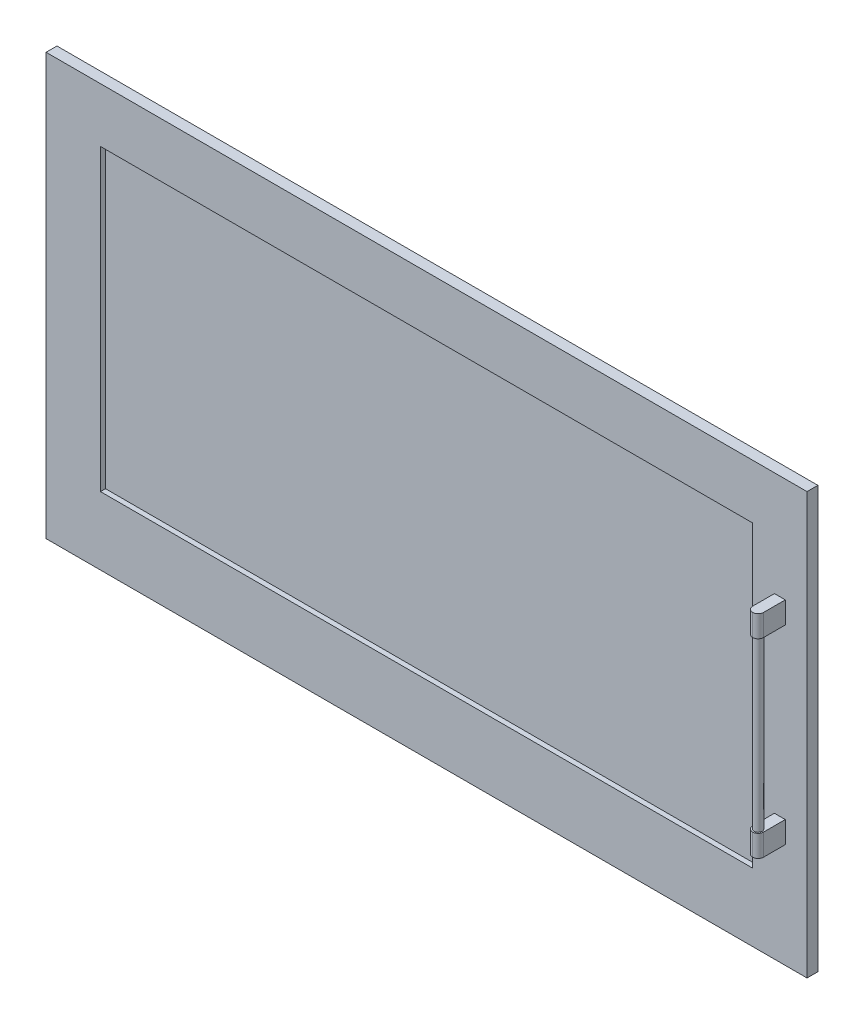
from build123d import *

# Parameters (mm, degrees)
SKETCH1_W                = 2800
SKETCH1_H                = 1550
BOSS_EXTRUDE1_DEPTH      = 40
SKETCH3_W                = 40
SKETCH3_H                = 80
BOSS_EXTRUDE4_DEPTH      = 100
FILLET1_R                = 20
LPATTERN1_COUNT          = 2
LPATTERN1_PITCH          = 700
FILLET1_OF_LPATTERN1_R   = 20
SKETCH4_R                = 15
BOSS_EXTRUDE5_DEPTH      = 620
SKETCH5_W                = 2400
SKETCH5_H                = 1100
CUT_EXTRUDE1_DEPTH       = 652
BOSS_EXTRUDE6_DEPTH      = 2
BOSS_EXTRUDE6_DEPTH_BACK = 2
SKETCH6_W                = 2399
SKETCH6_H                = 1099


with BuildPart() as part:
    # Sketch1 → Boss-Extrude1 (new body)
    with BuildSketch(Plane.XY):
        Rectangle(SKETCH1_W, SKETCH1_H)
    extrude(amount=BOSS_EXTRUDE1_DEPTH)

    # Sketch3 → Boss-Extrude4 (add)
    with BuildSketch(Plane.XY.offset(40)):
        with Locations((1300, 350)):
            Rectangle(SKETCH3_W, SKETCH3_H)
    boss_extrude4 = extrude(amount=BOSS_EXTRUDE4_DEPTH)

    # Fillet1
    fillet1_edges = [part.edges().sort_by_distance(p)[0] for p in [
        (1280, 350, 140),
        (1320, 350, 140),
    ]]
    fillet(fillet1_edges, radius=FILLET1_R - 0.0001)  # a hair under: the kernel refuses the full size

    # LPattern1: Boss-Extrude4 ×2
    with Locations(*[(0, -i * LPATTERN1_PITCH, 0) for i in range(1, LPATTERN1_COUNT)]):
        add(boss_extrude4)

    # Fillet1 of LPattern1
    fillet1_of_lpattern1_edges = [part.edges().sort_by_distance(p)[0] for p in [
        (1280, -350, 140),
        (1320, -350, 140),
    ]]
    fillet(fillet1_of_lpattern1_edges, radius=FILLET1_OF_LPATTERN1_R - 0.0001)  # a hair under: the kernel refuses the full size

    # Sketch4 → Boss-Extrude5 (add)
    with BuildSketch(Plane(origin=(0, -310, 0), x_dir=(1, 0, 0), z_dir=(0, 1, 0))):
        with Locations(Location((1300, -120, 0), (0, 0, 90))):
            Circle(SKETCH4_R)
    extrude(amount=BOSS_EXTRUDE5_DEPTH)

    # Sketch5 → Cut-Extrude1 (cut)
    with BuildSketch(Plane.XY.offset(40)):
        with Locations((0, 25)):
            Rectangle(SKETCH5_W, SKETCH5_H)
    extrude(amount=-CUT_EXTRUDE1_DEPTH, mode=Mode.SUBTRACT)


with BuildPart() as body_2:
    # Sketch6 → Boss-Extrude6 (new, two sides: drawn at the far end of the back side and taken through both)
    with BuildSketch(Plane.XY.offset(20).offset(-BOSS_EXTRUDE6_DEPTH_BACK)):
        with Locations((0, 25)):
            Rectangle(SKETCH6_W, SKETCH6_H)
    extrude(amount=BOSS_EXTRUDE6_DEPTH + BOSS_EXTRUDE6_DEPTH_BACK)


solid = Compound([part.part, body_2.part])
